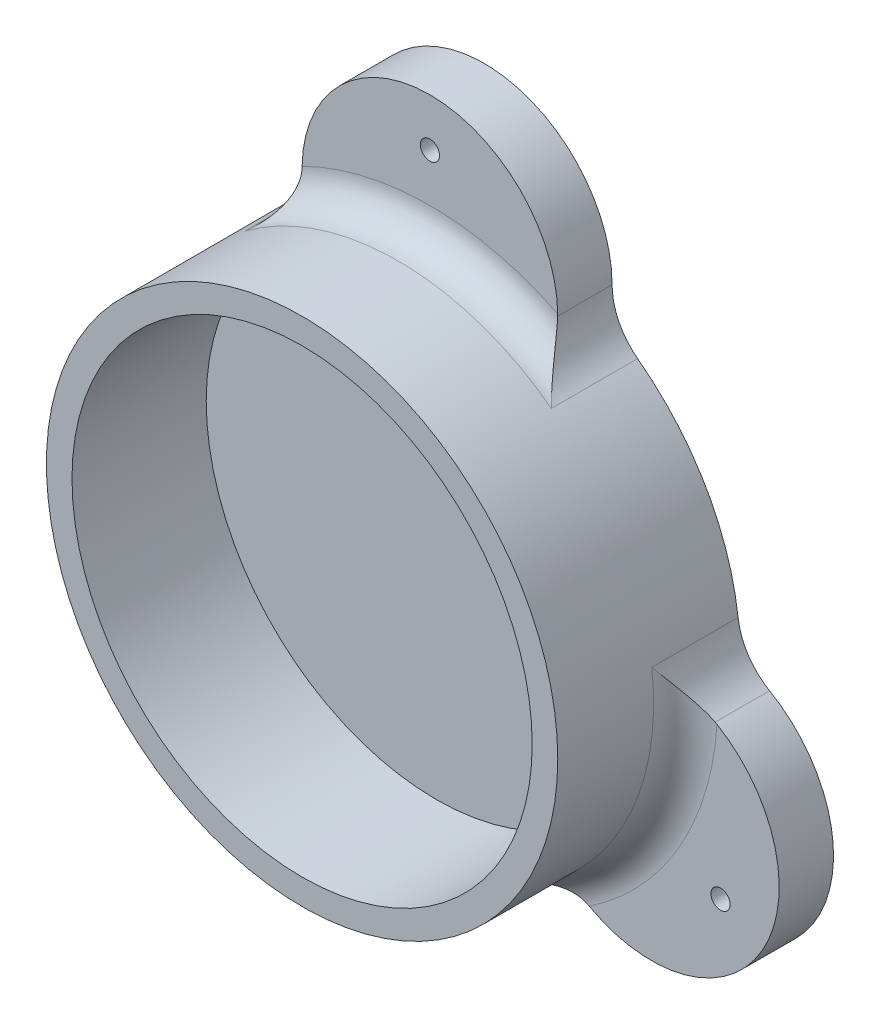
from build123d import *

# Parameters (mm, degrees)
ESTRUSIONE_ESTRUSIONE1_DEPTH = 8.5
RACCORDO1_R                  = 10
SCHIZZO2_R                   = 40
ESTRUSIONE_ESTRUSIONE2_DEPTH = 20
RACCORDO2_START              = 8.5
RACCORDO2_DEPTH              = 5.0000001
SCHIZZO3_R                   = 1.5
TAGLIO_ESTRUSIONE1_DEPTH     = 20
SCHIZZO4_R                   = 36
TAGLIO_ESTRUSIONE2_DEPTH     = 21


with BuildPart() as part:
    # Schizzo1 → Estrusione-Estrusione1 (new body)
    with BuildSketch(Plane.XY):
        with BuildLine():
            ThreePointArc((-20.628430767, -34.270509831), (0, -40), (20.628430767, -34.270509831))
            ThreePointArc((20.628430767, -34.270509831), (51.961524227, -30), (39.993347498, -0.729490169))
            ThreePointArc((39.993347498, -0.729490169), (34.641016151, 20), (19.364916731, 35))
            ThreePointArc((19.364916731, 35), (0, 60), (-19.364916731, 35))
            ThreePointArc((-19.364916731, 35), (-34.641016151, 20), (-39.993347498, -0.729490169))
            ThreePointArc((-39.993347498, -0.729490169), (-51.961524227, -30), (-20.628430767, -34.270509831))
        make_face()
    extrude(amount=ESTRUSIONE_ESTRUSIONE1_DEPTH)

    # Raccordo1
    raccordo1_edges = [part.edges().sort_by_distance(p)[0] for p in [
        (39.993347498, -0.729490169, 4.25),
        (20.628430767, -34.270509831, 4.25),
        (-20.628430767, -34.270509831, 4.25),
        (-39.993347498, -0.729490169, 4.25),
        (-19.364916731, 35, 4.25),
        (19.364916731, 35, 4.25),
    ]]
    fillet(raccordo1_edges, radius=RACCORDO1_R)

    # Schizzo2 → Estrusione-Estrusione2 (add)
    with BuildSketch(Plane.XY.offset(8.5)):
        with Locations(Location((0, 0, 0), (0, 0, 173.130102354))):
            Circle(SCHIZZO2_R)
    extrude(amount=ESTRUSIONE_ESTRUSIONE2_DEPTH)

    # Raccordo2: read off the stored shape, not the designer's step
    # Raccordo2 outline → Raccordo2 (add)
    with BuildSketch(Plane.XY.offset(RACCORDO2_START)):
        with BuildLine():
            ThreePointArc((-20, 40), (-21.05572809, 35.527864045), (-24, 32))
            ThreePointArc((-24, 32), (0, 40), (24, 32))
            ThreePointArc((24, 32), (21.05572809, 35.527864045), (20, 40))
            ThreePointArc((20, 40), (0, 60), (-20, 40))
        make_face()
        with BuildLine():
            ThreePointArc((-15.712812921, -36.784609691), (-34.641016151, -20), (-39.712812921, 4.784609691))
            ThreePointArc((-39.712812921, 4.784609691), (-41.29589685, 0.470863399), (-44.641016151, -2.679491924))
            ThreePointArc((-44.641016151, -2.679491924), (-51.961524227, -30), (-24.641016151, -37.320508076))
            ThreePointArc((-24.641016151, -37.320508076), (-20.24016876, -35.998727444), (-15.712812921, -36.784609691))
        make_face()
        with BuildLine():
            ThreePointArc((44.641016151, -2.679491924), (41.29589685, 0.470863399), (39.712812921, 4.784609691))
            ThreePointArc((39.712812921, 4.784609691), (34.641016151, -20), (15.712812921, -36.784609691))
            ThreePointArc((15.712812921, -36.784609691), (20.24016876, -35.998727444), (24.641016151, -37.320508076))
            ThreePointArc((24.641016151, -37.320508076), (51.961524227, -30), (44.641016151, -2.679491924))
        make_face()
    extrude(amount=RACCORDO2_DEPTH)

    # Raccordo2 2 outline → Raccordo2 2 (revolve, cut)
    with BuildSketch(Plane.XZ):
        with BuildLine():
            ThreePointArc((40, 13.5), (41.464466094, 9.964466094), (45, 8.5))
            Line((45, 8.5), (60, 8.5))
            Line((60, 8.5), (60, 13.5000001))
            Line((60, 13.5000001), (40, 13.5))
        make_face()
    revolve(axis=Axis((0, 0, 0), (0, 0, 1)), mode=Mode.SUBTRACT)

    # Schizzo3 → Taglio-Estrusione1 (cut)
    with BuildSketch(Plane.XY.offset(8.5)):
        with Locations((0, 52.5)):
            Circle(SCHIZZO3_R)
        with Locations((-45.466333699, -26.25)):
            Circle(SCHIZZO3_R)
        with Locations((45.466333699, -26.25)):
            Circle(SCHIZZO3_R)
    extrude(amount=-TAGLIO_ESTRUSIONE1_DEPTH, mode=Mode.SUBTRACT)

    # Schizzo4 → Taglio-Estrusione2 (cut)
    with BuildSketch(Plane.XY.offset(28.5)):
        Circle(SCHIZZO4_R)
    extrude(amount=-TAGLIO_ESTRUSIONE2_DEPTH, mode=Mode.SUBTRACT)


solid = part.part
